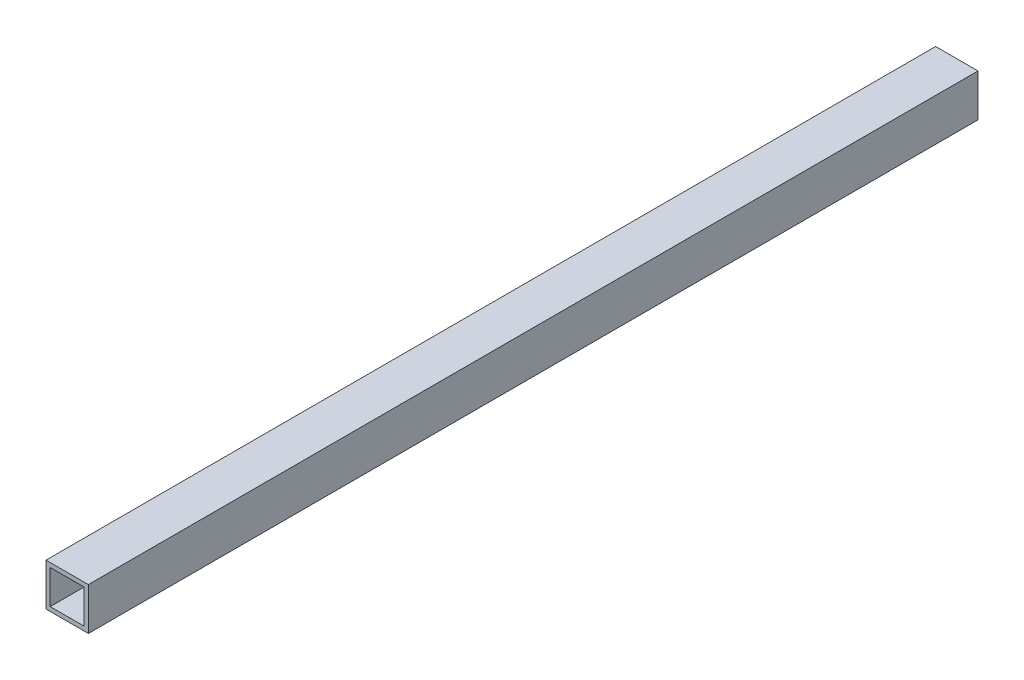
from build123d import *

# Parameters (mm, degrees)
SKETCH_1_W      = 10
SKETCH_1_H      = 10
SKETCH_1_W_2    = 8
SKETCH_1_H_2    = 8
EXTRUDE_1_DEPTH = 210


with BuildPart() as part:
    # 草图1 → 凸台-拉伸1 (new body)
    with BuildSketch(Plane.XY):
        Rectangle(SKETCH_1_W, SKETCH_1_H)
        Rectangle(SKETCH_1_W_2, SKETCH_1_H_2, mode=Mode.SUBTRACT)
    extrude(amount=EXTRUDE_1_DEPTH)


solid = part.part
